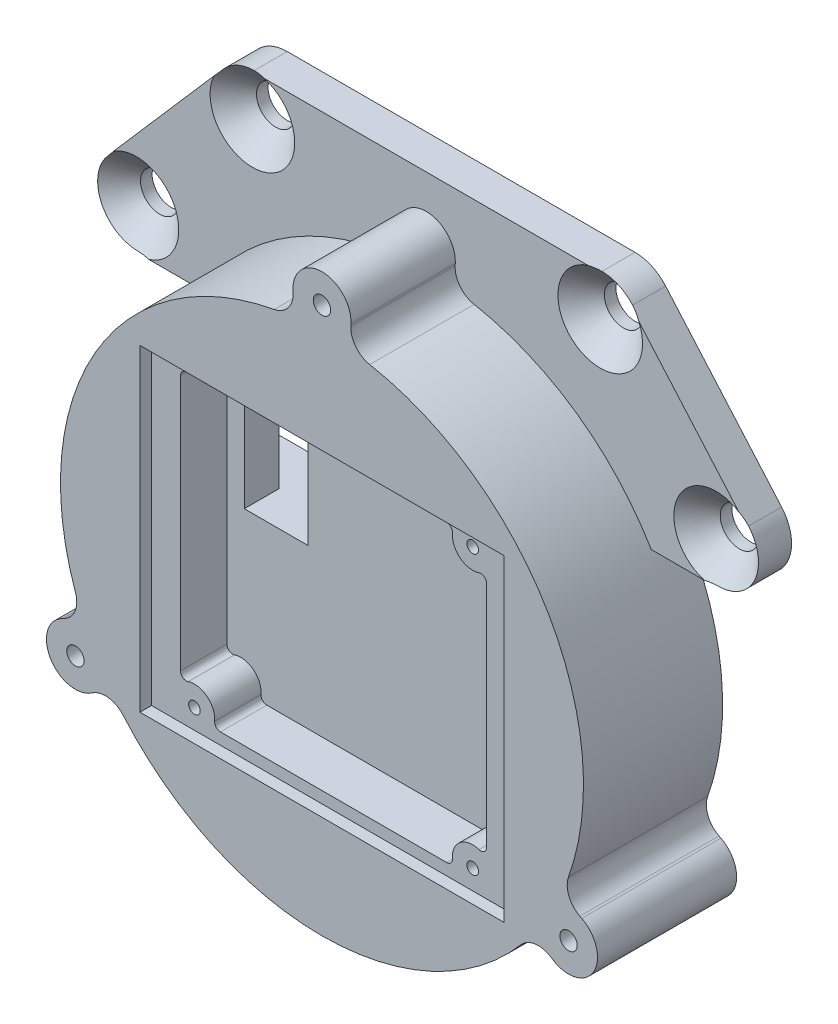
from build123d import *

# Parameters (mm, degrees)
SKETCH_1_R                       = 22.554804791
EXTRUDE_463_DEPTH                = 6
SKETCH_2_W                       = 31.4
SKETCH_2_H                       = 27.4
CUT_EXTRUDE_592_DEPTH            = 5
SKETCH_3_R                       = 1.75
SKETCH_3_R_2                     = 0.5
EXTRUDE_810_DEPTH                = 4
SKETCH_4_W                       = 5.5
SKETCH_4_H                       = 10.5
USB_DEPTH                        = 33.28681524
SKETCH_5_W                       = 31.4
SKETCH_5_H                       = 27.4
SKETCH_5_W_2                     = 26.4
SKETCH_5_H_2                     = 25.4
EXTRUDE_1363_DEPTH               = 4
FILLET_1_R                       = 0.5
EXTRUDE_START                    = 6
SKETCH_6_R                       = 22.554804791
SKETCH_6_W                       = 5.5
SKETCH_6_H                       = 10.5
EXTRUDE_1904_DEPTH               = 6
SKETCH_7_W                       = 10.832625661
SKETCH_7_H                       = 10.5
CUT_EXTRUDE_2094_DEPTH           = 4
SKETCH_8_R                       = 1.65
EXTRUDE_2468_DEPTH               = 3
CHAMFER_1_SIZE                   = 2
EXTRUDE_START_2                  = -12
SKETCH_14_R                      = 0.75
EXTRUDE_2869_DEPTH               = 12
FILLET_3_R                       = 2
PATTERN_CIRCULAR_1_COUNT         = 3
FILLET_3_OF_PATTERN_CIRCULAR_1_R = 2


with BuildPart() as part:
    # Эскиз1 → Extrude 463 (new body)
    with BuildSketch(Plane.XY):
        Circle(SKETCH_1_R)
    extrude(amount=EXTRUDE_463_DEPTH)

    # Эскиз2 → Cut-Extrude 592 (cut)
    with BuildSketch(Plane.XY.offset(6)):
        Rectangle(SKETCH_2_W, SKETCH_2_H)
    extrude(amount=-CUT_EXTRUDE_592_DEPTH, mode=Mode.SUBTRACT)

    # Эскиз3 → Extrude 810 (add)
    # profile 1 of 3: a face of its own
    with BuildSketch(Plane.XY.offset(1)):
        with Locations((-12, -12)):
            Circle(SKETCH_3_R)
        with Locations((-12, -12)):
            Circle(SKETCH_3_R_2, mode=Mode.SUBTRACT)
    # profile 2 of 3: a face of its own
    with BuildSketch(Plane.XY.offset(1)):
        with Locations((12, -12)):
            Circle(SKETCH_3_R)
        with Locations((12, -12)):
            Circle(SKETCH_3_R_2, mode=Mode.SUBTRACT)
    # profile 3 of 3: a face of its own
    with BuildSketch(Plane.XY.offset(1)):
        with Locations((12, 12)):
            Circle(SKETCH_3_R)
        with Locations((12, 12)):
            Circle(SKETCH_3_R_2, mode=Mode.SUBTRACT)
    extrude(amount=EXTRUDE_810_DEPTH)

    # Эскиз4 → usb (cut, through all)
    with BuildSketch(Plane.XY.offset(1)):
        with Locations((-8.95, 6.25)):
            Rectangle(SKETCH_4_W, SKETCH_4_H)
    extrude(amount=-USB_DEPTH, mode=Mode.SUBTRACT)

    # Эскиз5 → Extrude 1363 (add)
    with BuildSketch(Plane.XY.offset(1)):
        Rectangle(SKETCH_5_W, SKETCH_5_H)
        Rectangle(SKETCH_5_W_2, SKETCH_5_H_2, mode=Mode.SUBTRACT)
    extrude(amount=EXTRUDE_1363_DEPTH)

    # Скругление1
    fillet_1_edges = [part.edges().sort_by_distance(p)[0] for p in [
        (10.396098507, 12.7, 3),
        (13.2, 10.72622608, 3),
        (10.396098507, -12.7, 3),
        (-13.2, -10.72622608, 3),
        (-10.396098507, -12.7, 3),
        (13.2, -10.72622608, 3),
        (-13.2, 12.7, 3),
    ]]
    fillet(fillet_1_edges, radius=FILLET_1_R)

    # Эскиз6 → Extrude 1904 (add)
    with BuildSketch(Plane(origin=(0, 0, 0), x_dir=(-1, 0, 0), z_dir=(0, 0, -1)).offset(EXTRUDE_START)):
        Circle(SKETCH_6_R)
        with Locations((8.95, 6.25)):
            Rectangle(SKETCH_6_W, SKETCH_6_H, mode=Mode.SUBTRACT)
    extrude(amount=-EXTRUDE_1904_DEPTH)

    # Эскиз7 → Cut-Extrude 2094 (cut)
    with BuildSketch(Plane(origin=(0, 0, -6), x_dir=(-1, 0, 0), z_dir=(0, 0, -1))):
        with Locations((17.116312831, 6.25)):
            Rectangle(SKETCH_7_W, SKETCH_7_H)
    extrude(amount=-CUT_EXTRUDE_2094_DEPTH, mode=Mode.SUBTRACT)

    # Эскиз8 → Extrude 2468 (add)
    with BuildSketch(Plane(origin=(0, 0, -6), x_dir=(-1, 0, 0), z_dir=(0, 0, -1))):
        with BuildLine():
            Line((-25, 11.5), (-19.402814723, 11.5))
            ThreePointArc((-19.402814723, 11.5), (0, 22.554804791), (19.402814723, 11.5))
            Line((19.402814723, 11.5), (25, 11.5))
            ThreePointArc((25, 11.5), (28.184979534, 13.548826209), (27.641119328, 17.296625502))
            Line((27.641119328, 17.296625502), (17.641119328, 28.796625502))
            ThreePointArc((17.641119328, 28.796625502), (16.451173791, 29.684979534), (15, 30))
            Line((15, 30), (-15, 30))
            ThreePointArc((-15, 30), (-16.451173791, 29.684979534), (-17.641119328, 28.796625502))
            Line((-17.641119328, 28.796625502), (-27.641119328, 17.296625502))
            ThreePointArc((-27.641119328, 17.296625502), (-28.184979534, 13.548826209), (-25, 11.5))
        make_face()
        with Locations((-15, 26.5)):
            Circle(SKETCH_8_R, mode=Mode.SUBTRACT)
        with Locations((15, 26.5)):
            Circle(SKETCH_8_R, mode=Mode.SUBTRACT)
        with Locations((25, 15)):
            Circle(SKETCH_8_R, mode=Mode.SUBTRACT)
        with Locations((-25, 15)):
            Circle(SKETCH_8_R, mode=Mode.SUBTRACT)
    extrude(amount=-EXTRUDE_2468_DEPTH)

    # Фаска1
    # the kernel refuses this chamfer: 2 mm, written as the material it takes off along each edge
    with BuildSketch(Plane(origin=(-25, 15, -3), x_dir=(-1, 0, 0), z_dir=(0, -1, 0))) as chamfer_1_piece_1:
        Polygon((1.65 + CHAMFER_1_SIZE, 0), (1.65, CHAMFER_1_SIZE), (1.65, 0), align=None)
    revolve(axis=Axis((-25, 15, -3), (0, 0, -1)), mode=Mode.SUBTRACT)
    with BuildSketch(Plane(origin=(-15, 26.5, -3), x_dir=(-1, 0, 0), z_dir=(0, -1, 0))) as chamfer_1_piece_2:
        Polygon((1.65 + CHAMFER_1_SIZE, 0), (1.65, CHAMFER_1_SIZE), (1.65, 0), align=None)
    revolve(axis=Axis((-15, 26.5, -3), (0, 0, -1)), mode=Mode.SUBTRACT)
    with BuildSketch(Plane(origin=(25, 15, -3), x_dir=(-1, 0, 0), z_dir=(0, -1, 0))) as chamfer_1_piece_3:
        Polygon((1.65 + CHAMFER_1_SIZE, 0), (1.65, CHAMFER_1_SIZE), (1.65, 0), align=None)
    revolve(axis=Axis((25, 15, -3), (0, 0, -1)), mode=Mode.SUBTRACT)
    with BuildSketch(Plane(origin=(15, 26.5, -3), x_dir=(-1, 0, 0), z_dir=(0, -1, 0))) as chamfer_1_piece_4:
        Polygon((1.65 + CHAMFER_1_SIZE, 0), (1.65, CHAMFER_1_SIZE), (1.65, 0), align=None)
    revolve(axis=Axis((15, 26.5, -3), (0, 0, -1)), mode=Mode.SUBTRACT)

    # Эскиз14 → Extrude 2869 (add)
    with BuildSketch(Plane.XY.offset(6).offset(EXTRUDE_START_2)):
        with BuildLine():
            Line((-22.403248133, -10.051512893), (-20.620019257, -9.139695017))
            ThreePointArc((-20.620019257, -9.139695017), (-19.533033926, -11.277402396), (-18.225217696, -13.287612994))
            Line((-18.225217696, -13.287612994), (-19.906489578, -14.376025564))
            ThreePointArc((-19.906489578, -14.376025564), (-23.430148244, -13.527402396), (-22.403248133, -10.051512893))
        make_face()
        with Locations((-21.265084734, -12.277402396)):
            Circle(SKETCH_14_R, mode=Mode.SUBTRACT)
    extrude_2869 = extrude(amount=EXTRUDE_2869_DEPTH)

    # Скругление3
    fillet_3_edges = [part.edges().sort_by_distance(p)[0] for p in [
        (-20.620019257, -9.139695017, 0),
        (-18.225217696, -13.287612994, 0),
    ]]
    fillet(fillet_3_edges, radius=FILLET_3_R)

    # Круговой массив1: Extrude 2869 ×3 about axis
    pattern_circular_1_axis = Axis((0, 0, 0), (0, 0, 1))
    for i in range(1, PATTERN_CIRCULAR_1_COUNT):
        add(extrude_2869.rotate(pattern_circular_1_axis, i * 360 / PATTERN_CIRCULAR_1_COUNT))

    # Скругление3 of Круговой массив1
    fillet_3_of_pattern_circular_1_edges = [part.edges().sort_by_distance(p)[0] for p in [
        (18.225217696, -13.287612994, 0),
        (20.620019257, -9.139695017, 0),
        (2.394801561, 22.427308012, 0),
        (-2.394801561, 22.427308012, 0),
    ]]
    fillet(fillet_3_of_pattern_circular_1_edges, radius=FILLET_3_OF_PATTERN_CIRCULAR_1_R)


solid = part.part
